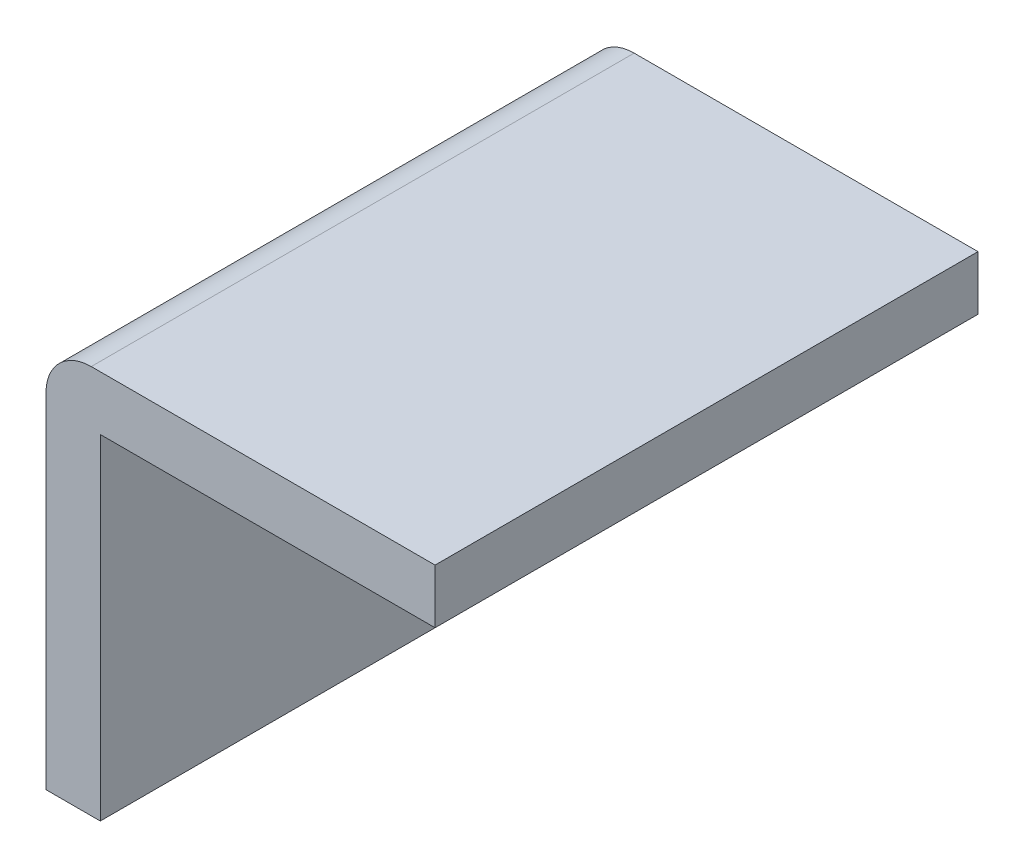
from build123d import *

# Parameters (mm, degrees)
BOSS_EXTRUDE1_DEPTH = 30


with BuildPart() as part:
    # Sketch1 → Boss-Extrude1 (new body)
    with BuildSketch(Plane.XY):
        with BuildLine():
            Line((-1.5, 0), (1.5, 0))
            Line((1.5, 0), (1.5, 18.5))
            Line((1.5, 18.5), (20, 18.5))
            Line((20, 18.5), (20, 21.5))
            Line((20, 21.5), (1, 21.5))
            ThreePointArc((1, 21.5), (-0.767766953, 20.767766953), (-1.5, 19))
            Line((-1.5, 19), (-1.5, 0))
        make_face()
    extrude(amount=BOSS_EXTRUDE1_DEPTH)


solid = part.part
